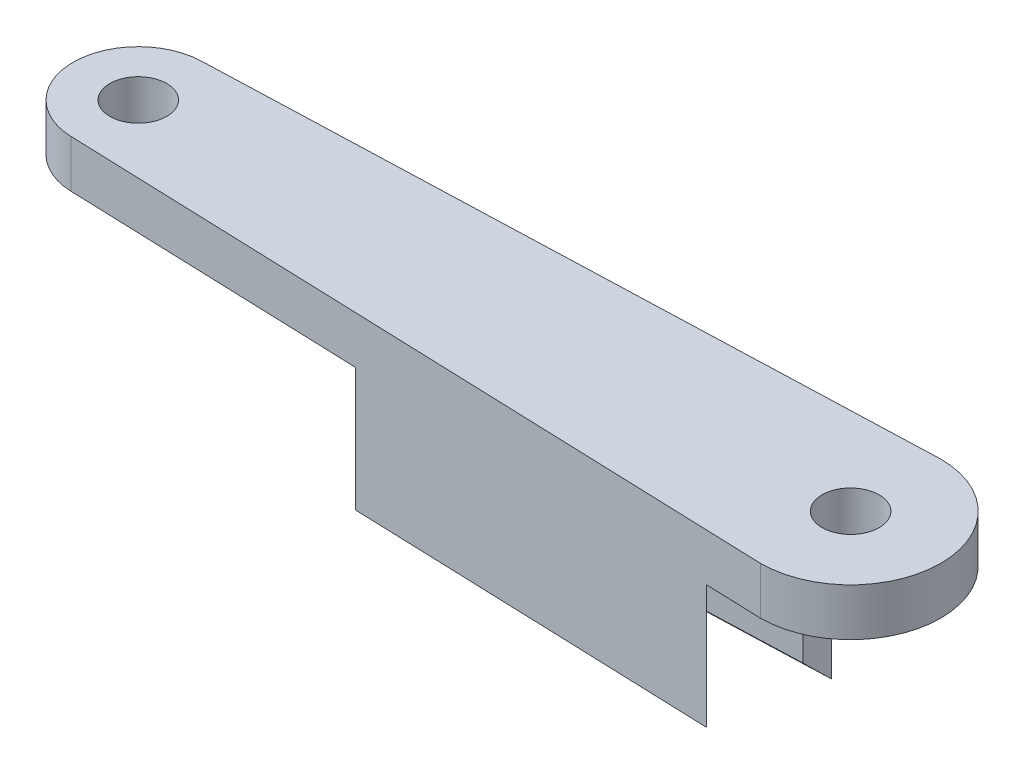
from build123d import *

# Parameters (mm, degrees)
SKETCH1_R               = 12
SKETCH1_R_2             = 6
BOSS_EXTRUDE1_DEPTH     = 10
SKETCH2_R               = 6
SKETCH2_R_2             = 12
BOSS_EXTRUDE3_DEPTH     = 10
BOSS_EXTRUDE4_DEPTH     = 26
CUT_EXTRUDE3_START      = -41
CUT_EXTRUDE3_DEPTH      = 41
CUT_EXTRUDE4_REACH      = 168.878
SKETCH7_R               = 6
SKETCH8_R               = 22
CUT_EXTRUDE5_DEPTH      = 26
BOSS_EXTRUDE5_DEPTH     = 3
CHAMFER1_SIZE           = 3
CUT_EXTRUDE7_DEPTH      = 172.13826848
CUT_EXTRUDE7_DEPTH_BACK = 172.13826848
SKETCH12_W              = 45
SKETCH12_H              = 36


with BuildPart() as part:
    # Sketch1 → Boss-Extrude1 (new body)
    with BuildSketch(Plane(origin=(0, 0, 0), x_dir=(1, 0, 0), z_dir=(0, 1, 0))):
        with Locations(Location((0, 0, 0), (0, 0, 270))):
            Circle(SKETCH1_R)
        with Locations(Location((0, 0, 0), (0, 0, 270))):
            Circle(SKETCH1_R_2, mode=Mode.SUBTRACT)
    extrude(amount=-BOSS_EXTRUDE1_DEPTH)

    # Sketch2 → Boss-Extrude3 (add)
    with BuildSketch(Plane(origin=(0, 0, 0), x_dir=(1, 0, 0), z_dir=(0, 1, 0))):
        with BuildLine():
            Line((-1.328372743, 18.953506954), (-200, 12))
            ThreePointArc((-200, 12), (-212, 0), (-200, -12))
            Line((-200, -12), (-1.328372743, -18.953506954))
            Line((-1.328372743, -18.953506954), (0, -19))
            ThreePointArc((0, -19), (19, 0), (0, 19))
            Line((0, 19), (-1.328372743, 18.953506954))
        make_face()
        with Locations(Location((-200, 0, 0), (0, 0, 270))):
            Circle(SKETCH2_R, mode=Mode.SUBTRACT)
        Circle(SKETCH2_R_2, mode=Mode.SUBTRACT)
    extrude(amount=-BOSS_EXTRUDE3_DEPTH)

    # Sketch3 → Boss-Extrude4 (add)
    with BuildSketch(Plane.XZ.offset(10)):
        with BuildLine():
            Line((-191.415216863, -12.30046741), (-11.76781879, -18.588126342))
            ThreePointArc((-11.76781879, -18.588126342), (-14.841660941, -16.239615159), (-17.45663787, -13.389017675))
            Line((-17.45663787, -13.389017675), (-186.984061419, -7.45555785))
            ThreePointArc((-186.984061419, -7.45555785), (-188.93130171, -10.123434109), (-191.415216863, -12.30046741))
        make_face()
        with BuildLine():
            Line((-186.984061419, 7.45555785), (-17.45663787, 13.389017675))
            ThreePointArc((-17.45663787, 13.389017675), (-14.841660941, 16.239615159), (-11.76781879, 18.588126342))
            Line((-11.76781879, 18.588126342), (-191.415216863, 12.30046741))
            ThreePointArc((-191.415216863, 12.30046741), (-188.93130171, 10.123434109), (-186.984061419, 7.45555785))
        make_face()
    extrude(amount=BOSS_EXTRUDE4_DEPTH)

    # Sketch6 → Cut-Extrude3 (cut)
    with BuildSketch(Plane.XZ.offset(36).offset(CUT_EXTRUDE3_START)):
        with BuildLine():
            Line((-200, 12), (-191.415216863, 12.30046741))
            Line((-191.415216863, 12.30046741), (-150.48066119, 13.733176858))
            ThreePointArc((-150.48066119, 13.733176858), (-163.741585855, 0), (-150.48066119, -13.733176858))
            Line((-150.48066119, -13.733176858), (-191.415216863, -12.30046741))
            Line((-191.415216863, -12.30046741), (-200, -12))
            ThreePointArc((-200, -12), (-212, 0), (-200, 12))
        make_face()
    extrude(amount=CUT_EXTRUDE3_DEPTH, mode=Mode.SUBTRACT)

    # Sketch7 → Cut-Extrude4 (cut, up to next)
    with BuildSketch(Plane.XZ.offset(10), mode=Mode.PRIVATE) as cut_extrude4_sk1:
        with Locations(Location((-150, 0, 0), (0, 0, 270))):
            Circle(SKETCH7_R)
    cut_extrude4_tool1 = extrude(cut_extrude4_sk1.sketch, amount=-CUT_EXTRUDE4_REACH, mode=Mode.PRIVATE) & part.part
    add(cut_extrude4_tool1.solids().sort_by_distance((-150, -10, 0))[0], mode=Mode.SUBTRACT)

    # Sketch8 → Cut-Extrude5 (cut)
    with BuildSketch(Plane(origin=(0, -36, 0), x_dir=(-1, 0, 0), z_dir=(0, -1, 0))):
        with Locations((150, 0)):
            Circle(SKETCH8_R)
    extrude(amount=-CUT_EXTRUDE5_DEPTH, mode=Mode.SUBTRACT)

    # Sketch10 → Boss-Extrude5 (add)
    with BuildSketch(Plane(origin=(-0.489400484, 0, -13.982870983), x_dir=(0.999388062160532, 0, -0.03497858217562234), z_dir=(0.03497858217562234, 0, 0.9993880621605321))):
        Polygon((-128.434604534, -26), (-16.977626637, -26), (-16.977626637, -36), (-16.977626637, -46), (-128.434604534, -46), align=None)
    extrude(amount=BOSS_EXTRUDE5_DEPTH)

    # Chamfer1
    chamfer1_edges = [part.edges().sort_by_distance(p)[0] for p in [
        (-17.351702123, -36, -10.390853488),
        (-73.0460887, -46, -8.441549958),
        (-128.740475277, -36, -6.492246428),
    ]]
    chamfer(chamfer1_edges, length=CHAMFER1_SIZE - 0.0001)  # a hair under: the kernel refuses the full size

    # Sketch12 → Cut-Extrude7 (cut, two sides: drawn at the far end of the back side and taken through both)
    with BuildSketch(Plane.XY.offset(-CUT_EXTRUDE7_DEPTH_BACK)):
        with Locations((-110.810696752, -28)):
            Rectangle(SKETCH12_W, SKETCH12_H)
    extrude(amount=CUT_EXTRUDE7_DEPTH + CUT_EXTRUDE7_DEPTH_BACK, mode=Mode.SUBTRACT)


solid = part.part
